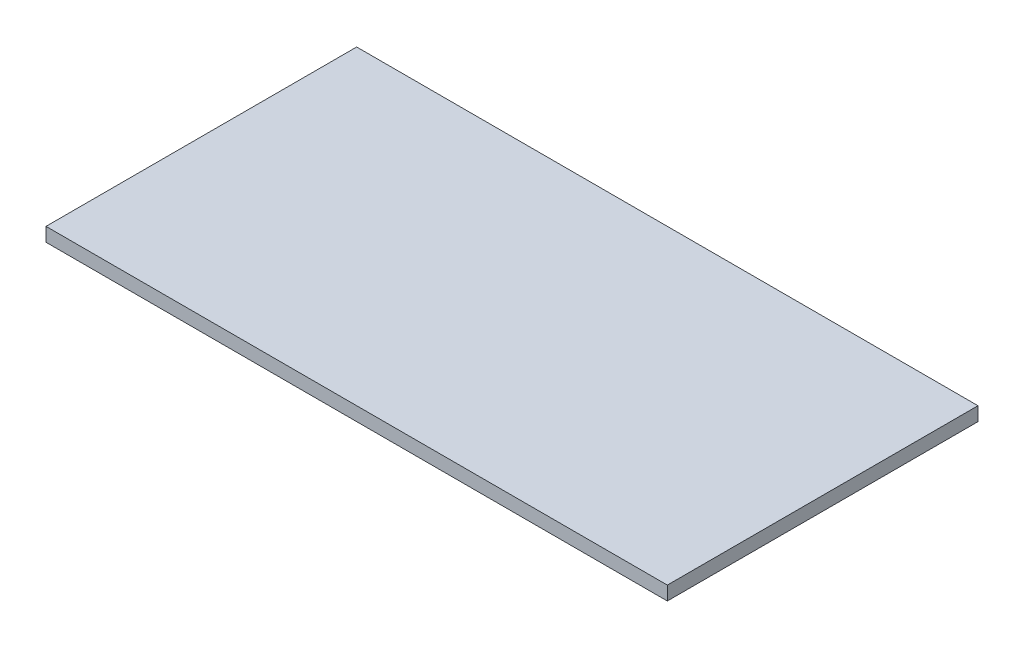
from build123d import *

# Parameters (mm, degrees)
SKETCH1_W           = 571.5
SKETCH1_H           = 12.7
BOSS_EXTRUDE1_DEPTH = 285.75


with BuildPart() as part:
    # Sketch1 → Boss-Extrude1 (new body)
    with BuildSketch(Plane.XY):
        Rectangle(SKETCH1_W, SKETCH1_H)
    extrude(amount=-BOSS_EXTRUDE1_DEPTH)


solid = part.part
